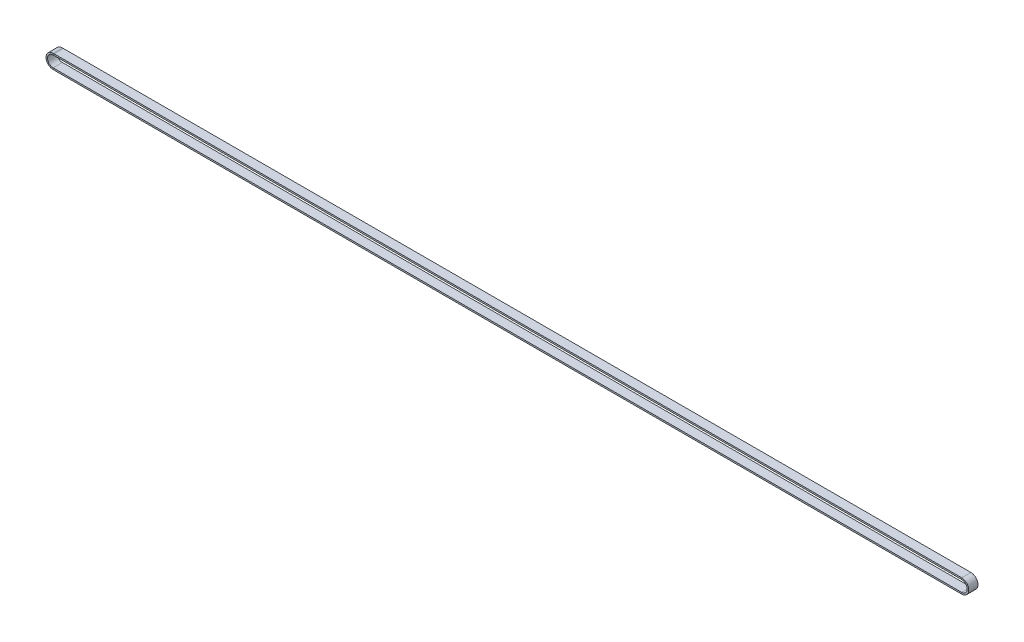
from build123d import *

# Parameters (mm, degrees)
SKETCH3_W = 9
SKETCH3_H = 1.5


with BuildPart() as part:
    # Sweep1: sweep along a path in Sketch2
    with BuildLine(Plane.XY) as sweep1_path:
        Line((-1, -89.604046937), (883.52063792, -89.604046937))
        ThreePointArc((883.52063792, -89.604046937), (890.42063792, -96.504046937), (883.52063792, -103.404046937))
        Line((883.52063792, -103.404046937), (-1, -103.404046937))
        ThreePointArc((-1, -103.404046937), (-7.9, -96.504046937), (-1, -89.604046937))
    # Sketch3 → Sweep1 (sweep)
    with BuildSketch(Plane(origin=(0, 0, 0), x_dir=(0, 0, -1), z_dir=(1, 0, 0))):
        with Locations((-4.5, -90.354046937)):
            Rectangle(SKETCH3_W, SKETCH3_H)
    sweep(path=sweep1_path.line)


solid = part.part
